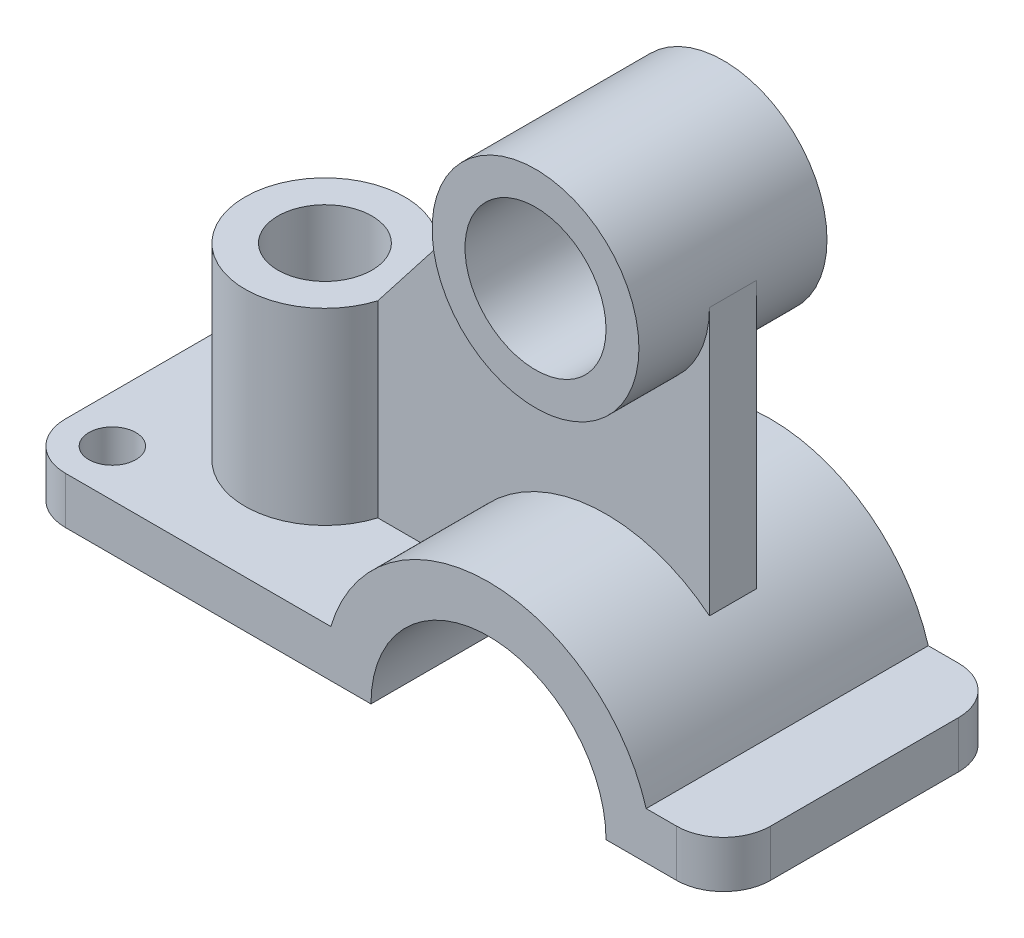
from build123d import *

# Parameters (mm, degrees)
BOSS_EXTRUDE1_DEPTH = 60
SKETCH2_R           = 20
SKETCH2_R_2         = 10
CUT_EXTRUDE5_DEPTH  = 120
SKETCH2_6_OUTSIDE_W = 368.122
SKETCH2_6_OUTSIDE_H = 188.122
CUT_EXTRUDE8_DEPTH  = 120
SKETCH1_4_R         = 30
BOSS_EXTRUDE2_DEPTH = 40
SKETCH2_8_R         = 20
BOSS_EXTRUDE3_DEPTH = 100
BOSS_EXTRUDE4_DEPTH = 10


with BuildPart() as part:
    # Sketch1 → Boss-Extrude1 (new, symmetric)
    with BuildSketch(Plane.XY):
        with BuildLine():
            Line((-97.082039325, 20), (-163.578192944, 20))
            Line((-163.578192944, 20), (-180, 20))
            Line((-180, 20), (-200, 20))
            Line((-200, 20), (-200, 0))
            Line((-200, 0), (-180, 0))
            Line((-180, 0), (-50, 0))
            ThreePointArc((-50, 0), (0, 50), (50, 0))
            Line((50, 0), (80, 0))
            Line((80, 0), (100, 0))
            Line((100, 0), (100, 20))
            Line((100, 20), (80, 20))
            Line((80, 20), (67.082039325, 20))
            ThreePointArc((67.082039325, 20), (58.149622197, 38.969493689), (44, 54.442630355))
            ThreePointArc((44, 54.442630355), (-20.730866632, 66.859787382), (-67.082039325, 20))
            Line((-67.082039325, 20), (-97.082039325, 20))
        make_face()
    extrude(amount=BOSS_EXTRUDE1_DEPTH, both=True)

    # Sketch2 → Cut-Extrude5 (cut)
    with BuildSketch(Plane(origin=(0, 0, 0), x_dir=(1, 0, 0), z_dir=(0, 1, 0))):
        with Locations((-129.578192944, 0)):
            Circle(SKETCH2_R)
        with Locations((-180, 40)):
            Circle(SKETCH2_R_2)
        with Locations((-180, -40)):
            Circle(SKETCH2_R_2)
    extrude(amount=CUT_EXTRUDE5_DEPTH, mode=Mode.SUBTRACT)

    # Sketch2<6> outside → Cut-Extrude8 (cut)
    with BuildSketch(Plane(origin=(0, 0, 0), x_dir=(1, 0, 0), z_dir=(0, 1, 0))):
        with Locations((-50, 0)):
            Rectangle(SKETCH2_6_OUTSIDE_W, SKETCH2_6_OUTSIDE_H)
        with BuildLine():
            ThreePointArc((-180, 60), (-194.142135624, 54.142135624), (-200, 40))
            Line((-200, 40), (-200, -40))
            ThreePointArc((-200, -40), (-194.142135624, -54.142135624), (-180, -60))
            Line((-180, -60), (80, -60))
            ThreePointArc((80, -60), (94.142135624, -54.142135624), (100, -40))
            Line((100, -40), (100, 40))
            ThreePointArc((100, 40), (94.142135624, 54.142135624), (80, 60))
            Line((80, 60), (-180, 60))
        make_face(mode=Mode.SUBTRACT)
    extrude(amount=CUT_EXTRUDE8_DEPTH, mode=Mode.SUBTRACT)

    # Sketch2<8> → Boss-Extrude3 (add)
    with BuildSketch(Plane(origin=(0, 0, 0), x_dir=(1, 0, 0), z_dir=(0, 1, 0))):
        with BuildLine():
            ThreePointArc((-97.082039325, 10), (-163.578192944, 0), (-97.082039325, -10))
            Line((-97.082039325, -10), (-97.082039325, 10))
        make_face()
        with Locations((-129.578192944, 0)):
            Circle(SKETCH2_8_R, mode=Mode.SUBTRACT)
    extrude(amount=BOSS_EXTRUDE3_DEPTH)



with BuildPart() as body_2:
    # Sketch1<4> → Boss-Extrude2 (new, symmetric)
    with BuildSketch(Plane.XY):
        with BuildLine():
            ThreePointArc((44, 168.052354843), (0, 212.052354843), (-44, 168.052354843))
            ThreePointArc((-44, 168.052354843), (0, 124.052354843), (44, 168.052354843))
        make_face()
        with Locations((0, 168.052354843)):
            Circle(SKETCH1_4_R, mode=Mode.SUBTRACT)
    extrude(amount=BOSS_EXTRUDE2_DEPTH, both=True)


with BuildPart() as part_1:
    add(part.part)

    add(body_2.part)  # Boss-Extrude4 merges body 2
    # Sketch1<5> → Boss-Extrude4 (add, symmetric)
    with BuildSketch(Plane.XY):
        with BuildLine():
            Line((-44, 168.052354843), (-97.082039325, 100))
            Line((-97.082039325, 100), (-97.082039325, 20))
            Line((-97.082039325, 20), (-67.082039325, 20))
            ThreePointArc((-67.082039325, 20), (-20.730866632, 66.859787382), (44, 54.442630355))
            Line((44, 54.442630355), (44, 168.052354843))
            ThreePointArc((44, 168.052354843), (0, 124.052354843), (-44, 168.052354843))
        make_face()
    extrude(amount=BOSS_EXTRUDE4_DEPTH, both=True)


solid = part_1.part
